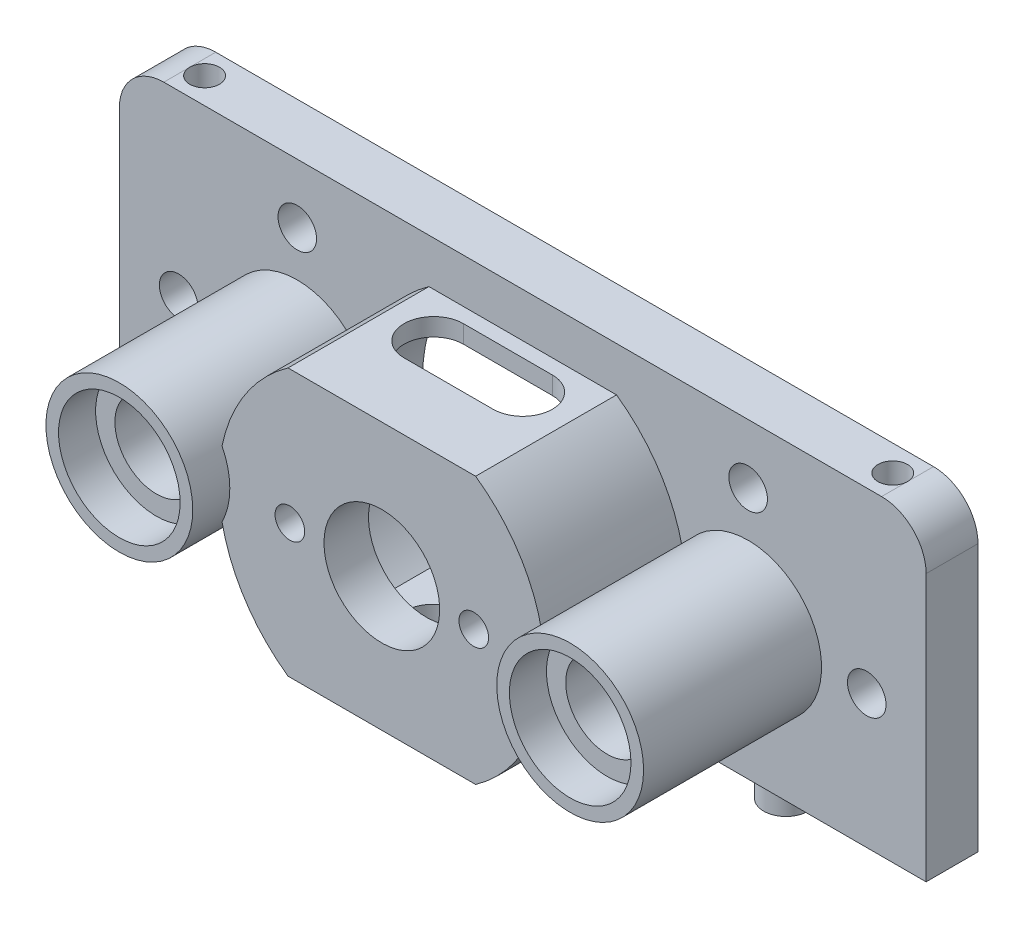
from build123d import *

# Parameters (mm, degrees)
SKETCH_2_R               = 3.9
SKETCH_2_R_2             = 4.1
SKETCH_2_R_3             = 1
SKETCH_2_R_4             = 1.3
EXTRUDE_1_DEPTH          = 3.5
SKETCH_2_4_R             = 4.1
SKETCH_2_4_R_2           = 2.8
EXTRUDE_2_DEPTH          = 1
CUT_EXTRUDE_1_DEPTH      = 41.636067723
CUT_EXTRUDE_1_DEPTH_BACK = 41.636067723
SKETCH_3_W               = 54.4
SKETCH_3_H               = 21
FILLET_1_R               = 3
CUT_EXTRUDE_2_DEPTH      = 35.541134897
CUT_EXTRUDE_2_DEPTH_BACK = 7
SKETCH_4_R               = 1
SKETCH_4_4_R             = 1.5
EXTRUDE_3_DEPTH          = 1.6
SKETCH_5_R               = 1
SKETCH_5_R_2             = 3.9
EXTRUDE_4_DEPTH          = 13
SKETCH_6_R               = 1
SKETCH_6_R_2             = 3.9
CUT_EXTRUDE_3_DEPTH      = 10
CUT_EXTRUDE_4_DEPTH      = 36.958309193
CUT_EXTRUDE_4_DEPTH_BACK = 36.958309193
SKETCH_2_5_R             = 4.1
SKETCH_2_5_R_2           = 2.8
EXTRUDE_5_DEPTH          = 13
SKETCH_8_R               = 4.1
EXTRUDE_6_DEPTH          = 12
EXTRUDE_START            = 9.5
EXTRUDE_7_DEPTH          = 2.5
SKETCH_2_6_R             = 4.1
SKETCH_2_6_R_2           = 2.8
CUT_EXTRUDE_10_DEPTH     = 2.5
SKETCH_9_R               = 1
CUT_EXTRUDE_11_DEPTH     = 6


# Read off the part's stored shape, not the designer's step: 凸台-拉伸7
with BuildPart() as part:
    # 草图2 → 凸台-拉伸1 (new body)
    with BuildSketch(Plane.XY):
        with BuildLine():
            Line((15.2, -20), (-15.2, -20))
            ThreePointArc((-15.2, -20), (-35.2, 0), (-15.2, 20))
            Line((-15.2, 20), (15.2, 20))
            ThreePointArc((15.2, 20), (35.2, 0), (15.2, -20))
        make_face()
        Circle(SKETCH_2_R, mode=Mode.SUBTRACT)
        with Locations((-15.2, 0)):
            Circle(SKETCH_2_R_2, mode=Mode.SUBTRACT)
        with Locations((15.2, 0)):
            Circle(SKETCH_2_R_2, mode=Mode.SUBTRACT)
        with Locations((-6.2, 0)):
            Circle(SKETCH_2_R_3, mode=Mode.SUBTRACT)
        with Locations((6.2, 0)):
            Circle(SKETCH_2_R_3, mode=Mode.SUBTRACT)
        with Locations((-15.2, 8)):
            Circle(SKETCH_2_R_4, mode=Mode.SUBTRACT)
        with Locations((-23.2, 0)):
            Circle(SKETCH_2_R_4, mode=Mode.SUBTRACT)
        with Locations((23.2, 0)):
            Circle(SKETCH_2_R_4, mode=Mode.SUBTRACT)
        with Locations((15.2, 8)):
            Circle(SKETCH_2_R_4, mode=Mode.SUBTRACT)
    extrude(amount=EXTRUDE_1_DEPTH)

    # 草图2<4> → 凸台-拉伸2 (add)
    # profile 1 of 2: a face of its own
    with BuildSketch(Plane.XY):
        with Locations((-15.2, 0)):
            Circle(SKETCH_2_4_R)
        with Locations((-15.2, 0)):
            Circle(SKETCH_2_4_R_2, mode=Mode.SUBTRACT)
    # profile 2 of 2: a face of its own
    with BuildSketch(Plane.XY):
        with Locations((15.2, 0)):
            Circle(SKETCH_2_4_R)
        with Locations((15.2, 0)):
            Circle(SKETCH_2_4_R_2, mode=Mode.SUBTRACT)
    extrude(amount=EXTRUDE_2_DEPTH)

    # 草图3 → 切除-拉伸1 (cut, two sides: drawn at the far end of the back side and taken through both)
    with BuildSketch(Plane.XY.offset(3.5).offset(-CUT_EXTRUDE_1_DEPTH_BACK)):
        with BuildLine():
            Line((15.2, -20), (-15.2, -20))
            ThreePointArc((-15.2, -20), (-35.2, 0), (-15.2, 20))
            Line((-15.2, 20), (15.2, 20))
            ThreePointArc((15.2, 20), (35.2, 0), (15.2, -20))
        make_face()
        with Locations((0, 1.5)):
            Rectangle(SKETCH_3_W, SKETCH_3_H, mode=Mode.SUBTRACT)
    extrude(amount=CUT_EXTRUDE_1_DEPTH + CUT_EXTRUDE_1_DEPTH_BACK, mode=Mode.SUBTRACT)

    # 圆角1
    fillet_1_edges = [part.edges().sort_by_distance(p)[0] for p in [
        (27.2, 12, 1.75),
        (-27.2, 12, 1.75),
    ]]
    fillet(fillet_1_edges, radius=FILLET_1_R)

    # 草图4 → 切除-拉伸2 (cut, two sides: drawn at the far end of the back side and taken through both)
    with BuildSketch(Plane.XZ.offset(9).offset(-CUT_EXTRUDE_2_DEPTH_BACK)):
        with Locations(Location((-24, 1.75, 0), (0, 0, 90))):
            Circle(SKETCH_4_R)
        with Locations(Location((24, 1.75, 0), (0, 0, 90))):
            Circle(SKETCH_4_R)
    extrude(amount=CUT_EXTRUDE_2_DEPTH + CUT_EXTRUDE_2_DEPTH_BACK, mode=Mode.SUBTRACT)

    # 草图4<4> → 凸台-拉伸3 (add)
    with BuildSketch(Plane.XZ.offset(9)):
        with Locations(Location((-16, 1.75, 0), (0, 0, 270))):
            Circle(SKETCH_4_4_R)
        with Locations(Location((16, 1.75, 0), (0, 0, 270))):
            Circle(SKETCH_4_4_R)
    extrude(amount=EXTRUDE_3_DEPTH)

    # 草图5 → 凸台-拉伸4 (add)
    with BuildSketch(Plane(origin=(0, 0, 0), x_dir=(-1, 0, 0), z_dir=(0, 0, -1))):
        with BuildLine():
            Line((6.32455532, 9), (-6.32455532, 9))
            ThreePointArc((-6.32455532, 9), (-11, 0), (-6.32455532, -9))
            Line((-6.32455532, -9), (6.32455532, -9))
            ThreePointArc((6.32455532, -9), (9.761406367, -5.070990607), (11, 0))
            ThreePointArc((11, 0), (9.761406367, 5.070990607), (6.32455532, 9))
        make_face()
        with Locations((-6.2, 0)):
            Circle(SKETCH_5_R, mode=Mode.SUBTRACT)
        Circle(SKETCH_5_R_2, mode=Mode.SUBTRACT)
        with Locations((6.2, 0)):
            Circle(SKETCH_5_R, mode=Mode.SUBTRACT)
    extrude(amount=-EXTRUDE_4_DEPTH)

    # 草图6 → 切除-拉伸3 (cut)
    with BuildSketch(Plane(origin=(0, 0, 0), x_dir=(-1, 0, 0), z_dir=(0, 0, -1))):
        with BuildLine():
            Line((6.65, 7.8), (-6.65, 7.8))
            ThreePointArc((-6.65, 7.8), (-10.25, 0), (-6.65, -7.8))
            Line((-6.65, -7.8), (6.65, -7.8))
            ThreePointArc((6.65, -7.8), (9.306583691, -4.295346319), (10.25, 0))
            ThreePointArc((10.25, 0), (9.306583691, 4.295346319), (6.65, 7.8))
        make_face()
        with Locations((-6.2, 0)):
            Circle(SKETCH_6_R, mode=Mode.SUBTRACT)
        Circle(SKETCH_6_R_2, mode=Mode.SUBTRACT)
        with Locations((6.2, 0)):
            Circle(SKETCH_6_R, mode=Mode.SUBTRACT)
    extrude(amount=-CUT_EXTRUDE_3_DEPTH, mode=Mode.SUBTRACT)

    # 草图7 → 切除-拉伸4 (cut, two sides: drawn at the far end of the back side and taken through both)
    with BuildSketch(Plane(origin=(0, 9, 0), x_dir=(1, 0, 0), z_dir=(0, 1, 0)).offset(-CUT_EXTRUDE_4_DEPTH_BACK)):
        with BuildLine():
            Line((-3, -4.5), (3, -4.5))
            ThreePointArc((3, -4.5), (5, -6.5), (3, -8.5))
            Line((3, -8.5), (-3, -8.5))
            ThreePointArc((-3, -8.5), (-5, -6.5), (-3, -4.5))
        make_face()
    extrude(amount=CUT_EXTRUDE_4_DEPTH + CUT_EXTRUDE_4_DEPTH_BACK, mode=Mode.SUBTRACT)

    # 草图2<5> → 凸台-拉伸5 (add)
    # profile 1 of 2: a face of its own
    with BuildSketch(Plane.XY):
        with Locations(Location((-15.2, 0, 0), (0, 0, 180))):
            Circle(SKETCH_2_5_R)
        with Locations((-15.2, 0)):
            Circle(SKETCH_2_5_R_2, mode=Mode.SUBTRACT)
    # profile 2 of 2: a face of its own
    with BuildSketch(Plane.XY):
        with Locations(Location((15.2, 0, 0), (0, 0, 180))):
            Circle(SKETCH_2_5_R)
        with Locations((15.2, 0)):
            Circle(SKETCH_2_5_R_2, mode=Mode.SUBTRACT)
    extrude(amount=EXTRUDE_5_DEPTH)

    # 草图8 → 凸台-拉伸6 (add)
    # profile 1 of 2: a face of its own
    with BuildSketch(Plane.XY.offset(3.5)):
        with BuildLine():
            ThreePointArc((-10.774259868, -2.217053064), (-11, 0), (-10.774259868, 2.217053064))
            ThreePointArc((-10.774259868, 2.217053064), (-20.15, 0), (-10.774259868, -2.217053064))
        make_face()
        with Locations((-15.2, 0)):
            Circle(SKETCH_8_R, mode=Mode.SUBTRACT)
    # profile 2 of 2: a face of its own
    with BuildSketch(Plane.XY.offset(3.5)):
        with BuildLine():
            ThreePointArc((10.774259868, -2.217053064), (16.339097526, -4.817152356), (20.15, 0))
            ThreePointArc((20.15, 0), (16.339097526, 4.817152356), (10.774259868, 2.217053064))
            ThreePointArc((10.774259868, 2.217053064), (11, 0), (10.774259868, -2.217053064))
        make_face()
        with Locations((15.2, 0)):
            Circle(SKETCH_8_R, mode=Mode.SUBTRACT)
    extrude(amount=EXTRUDE_6_DEPTH)

    # 凸台-拉伸7 outline → 凸台-拉伸7 (add)
    with BuildSketch(Plane.XY.offset(3.5).offset(EXTRUDE_START)):
        with BuildLine():
            ThreePointArc((-10.774259868, -2.217053064), (-10.25, 0), (-10.774259868, 2.217053064))
            ThreePointArc((-10.774259868, 2.217053064), (-11, 0), (-10.774259868, -2.217053064))
        make_face()
        with BuildLine():
            ThreePointArc((10.774259868, -2.217053064), (11, 0), (10.774259868, 2.217053064))
            ThreePointArc((10.774259868, 2.217053064), (10.25, 0), (10.774259868, -2.217053064))
        make_face()
    extrude(amount=EXTRUDE_7_DEPTH)

    # 草图2<6> → 切除-拉伸10 (cut)
    # profile 1 of 2: a face of its own
    with BuildSketch(Plane.XY):
        with Locations((-15.2, 0)):
            Circle(SKETCH_2_6_R)
        with Locations((-15.2, 0)):
            Circle(SKETCH_2_6_R_2, mode=Mode.SUBTRACT)
    # profile 2 of 2: a face of its own
    with BuildSketch(Plane.XY):
        with Locations((15.2, 0)):
            Circle(SKETCH_2_6_R)
        with Locations((15.2, 0)):
            Circle(SKETCH_2_6_R_2, mode=Mode.SUBTRACT)
    extrude(amount=CUT_EXTRUDE_10_DEPTH, mode=Mode.SUBTRACT)

    # 草图9 → 切除-拉伸11 (cut)
    with BuildSketch(Plane(origin=(0, 12, 0), x_dir=(1, 0, 0), z_dir=(0, 1, 0))):
        with Locations(Location((-23.2, -1.75, 0), (0, 0, 270))):
            Circle(SKETCH_9_R)
        with Locations(Location((23.2, -1.75, 0), (0, 0, 270))):
            Circle(SKETCH_9_R)
    extrude(amount=-CUT_EXTRUDE_11_DEPTH, mode=Mode.SUBTRACT)


solid = part.part
